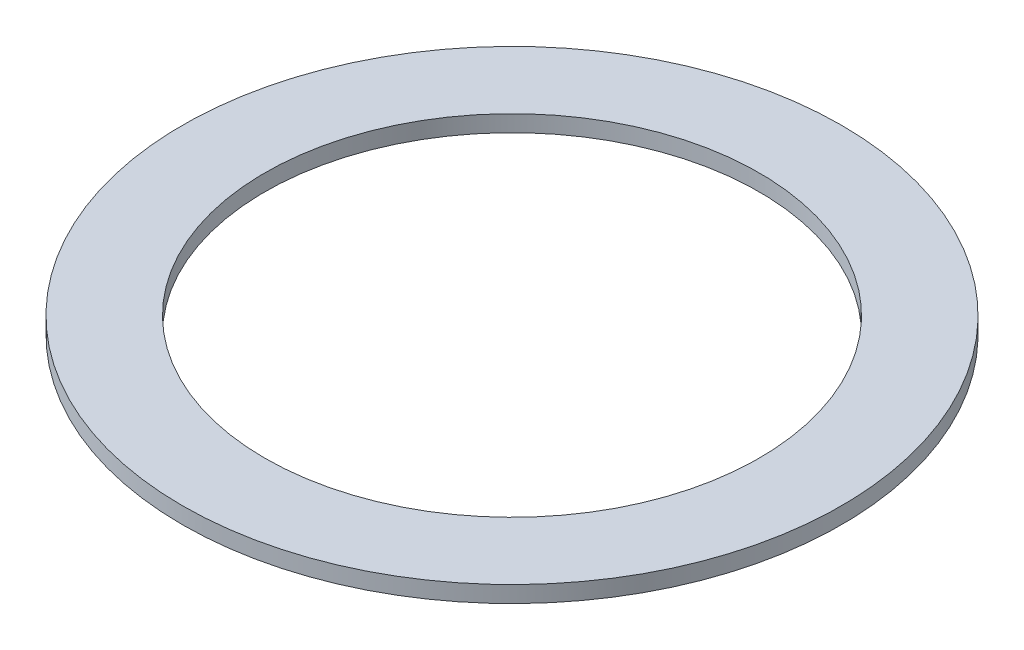
from build123d import *

# Parameters (mm, degrees)
SKETCH2_R           = 10
SKETCH2_R_2         = 7.5
BOSS_EXTRUDE2_DEPTH = 0.5


with BuildPart() as part:
    # Sketch2 → Boss-Extrude2 (new body)
    with BuildSketch(Plane(origin=(0, 0, 0), x_dir=(1, 0, 0), z_dir=(0, 1, 0))):
        Circle(SKETCH2_R)
        Circle(SKETCH2_R_2, mode=Mode.SUBTRACT)
    extrude(amount=BOSS_EXTRUDE2_DEPTH)


solid = part.part
